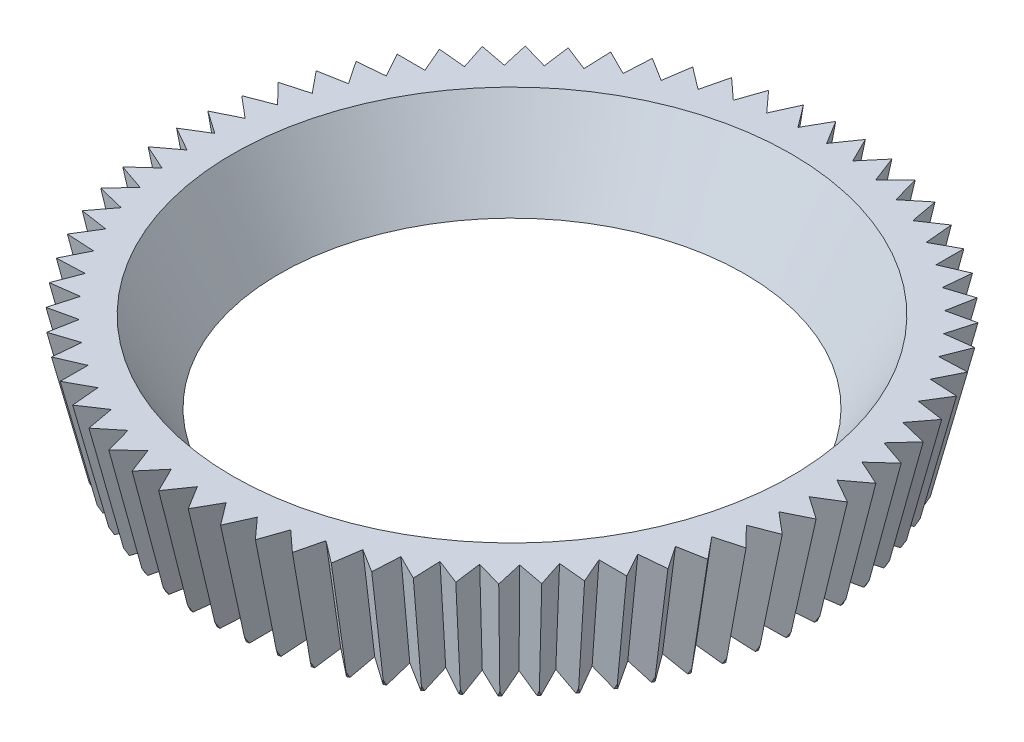
from build123d import *

# Parameters (mm, degrees)
CUT_EXTRUDE1_DEPTH = 14.121487603
CUT_EXTRUDE1_TAPER = -7
CIRPATTERN1_COUNT  = 68


with BuildPart() as part:
    # Sketch1 → Revolve1 (revolve)
    with BuildSketch(Plane.XY):
        Polygon((8.024519053, 11.810417438), (9, 13.5), (9, 15), (7.5, 15), (6.25, 12.834936491), align=None)
    revolve(axis=Axis((0, 11.810417438, 0), (0, 1, 0)))

    # Sketch2 → Cut-Extrude1 (cut, through all)
    with BuildSketch(Plane(origin=(0, 15, 0), x_dir=(1, 0, 0), z_dir=(0, 1, 0))):
        with BuildLine():
            ThreePointArc((0.073895723, -8.999696629), (0.574787064, -8.981626792), (1.073895723, -8.935700755))
            Line((1.073895723, -8.935700755), (0.525062125, -8.204624539))
            Line((0.525062125, -8.204624539), (0.073895723, -8.999696629))
        make_face()
    cut_extrude1 = extrude(amount=-CUT_EXTRUDE1_DEPTH, taper=CUT_EXTRUDE1_TAPER, mode=Mode.SUBTRACT)

    # CirPattern1: Cut-Extrude1 ×68 about axis
    cirpattern1_axis = Axis((0, 15, 0), (0, -1, 0))
    for i in range(1, CIRPATTERN1_COUNT):
        add(cut_extrude1.rotate(cirpattern1_axis, i * 360 / CIRPATTERN1_COUNT), mode=Mode.SUBTRACT)


solid = part.part
